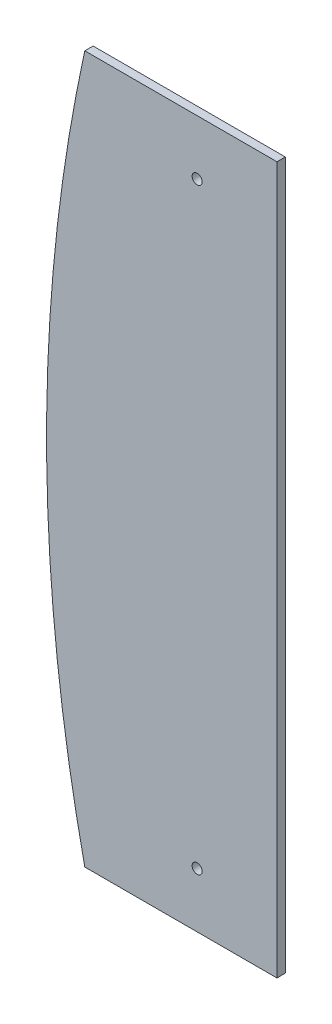
from build123d import *

# Parameters (mm, degrees)
BOSS_EXTRUDE1_DEPTH    = 10
F_12_0MM_DOWEL_HOLE1_D = 12


with BuildPart() as part:
    # Sketch1 → Boss-Extrude1 (new body)
    with BuildSketch(Plane.XY):
        with BuildLine():
            Line((80.346888759, -434.280846738), (80.346888759, 415.719153262))
            Line((80.346888759, 415.719153262), (-150.716671704, 415.719153262))
            ThreePointArc((-150.716671704, 415.719153262), (-196.653111241, -9.280846738), (-150.716671704, -434.280846738))
            Line((-150.716671704, -434.280846738), (80.346888759, -434.280846738))
        make_face()
    extrude(amount=BOSS_EXTRUDE1_DEPTH)

    # Ø12.0mm Dowel Hole1 (through all)
    with Locations(Plane(origin=(-15.653111241, 349.719153262, 0), x_dir=(-1, 0, 0), z_dir=(0, 0, -1))):
        with Locations((0, 0), (0, -718)):
            Hole(F_12_0MM_DOWEL_HOLE1_D / 2)


solid = part.part
